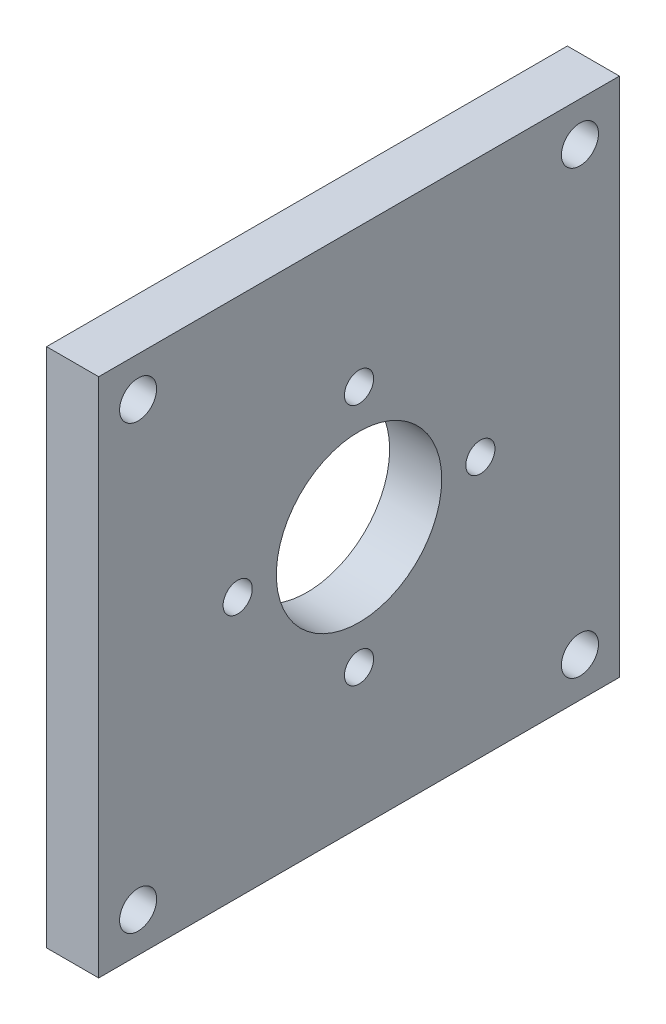
from build123d import *

# Parameters (mm, degrees)
SKETCH1_W                    = 31.75
SKETCH1_H                    = 31.75
BOSS_EXTRUDE1_DEPTH          = 3.175
X_0_397_DIAMETER_HOLE1_D     = 10.0838
X_0_397_DIAMETER_HOLE1_DEPTH = 12.7
X_0_397_DIAMETER_HOLE1_TIP   = 3.029479155
CIRPATTERN1_COUNT            = 4
CIRPATTERN2_COUNT            = 4


with BuildPart() as part:
    # Sketch1 → Boss-Extrude1 (new body)
    with BuildSketch(Plane(origin=(0, 0, 0), x_dir=(0, 0, -1), z_dir=(1, 0, 0))):
        Rectangle(SKETCH1_W, SKETCH1_H)
    extrude(amount=BOSS_EXTRUDE1_DEPTH)

    # X (0.397) Diameter Hole1
    with Locations(Plane(origin=(3.175, 0, 0), x_dir=(0, 0, -1), z_dir=(1, 0, 0))):
        with Locations((0, 0)):
            Hole(X_0_397_DIAMETER_HOLE1_D / 2, depth=X_0_397_DIAMETER_HOLE1_DEPTH)
            with Locations((0, 0, -(X_0_397_DIAMETER_HOLE1_DEPTH + X_0_397_DIAMETER_HOLE1_TIP / 2))):  # 118° drill point
                Cone(0, X_0_397_DIAMETER_HOLE1_D / 2, X_0_397_DIAMETER_HOLE1_TIP, mode=Mode.SUBTRACT)

    # Sketch4 → #2-56 Tapped Hole1 (revolve, cut)
    with BuildSketch(Plane(origin=(3.175, 7.4, 0), x_dir=(0, 0, -1), z_dir=(0, 1, 0))):
        Polygon((0, 0), (0, 7.13816509), (0.889, 6.604), (0.889, 0), align=None)
    f_2_56_tapped_hole1 = revolve(axis=Axis((9.525, 7.4, 0), (-1, 0, 0)), mode=Mode.SUBTRACT)

    # CirPattern1: #2-56 Tapped Hole1 ×4 about axis
    cirpattern1_axis = Axis((3.175, 0, 0), (1, 0, 0))
    for i in range(1, CIRPATTERN1_COUNT):
        add(f_2_56_tapped_hole1.rotate(cirpattern1_axis, i * 360 / CIRPATTERN1_COUNT), mode=Mode.SUBTRACT)

    # Sketch6 → #4-40 Tapped Hole1 (revolve, cut)
    with BuildSketch(Plane(origin=(3.175, 13.470384182, 13.470384182), x_dir=(0, 0, -1), z_dir=(0, 1, 0))):
        Polygon((0, 0), (0, 9.569152758), (1.1303, 8.89), (1.1303, 0), align=None)
    f_4_40_tapped_hole1 = revolve(axis=Axis((9.525, 13.470384182, 13.470384182), (-1, 0, 0)), mode=Mode.SUBTRACT)

    # CirPattern2: #4-40 Tapped Hole1 ×4 about axis
    cirpattern2_axis = Axis((3.175, 0, 0), (1, 0, 0))
    for i in range(1, CIRPATTERN2_COUNT):
        add(f_4_40_tapped_hole1.rotate(cirpattern2_axis, i * 360 / CIRPATTERN2_COUNT), mode=Mode.SUBTRACT)


solid = part.part
